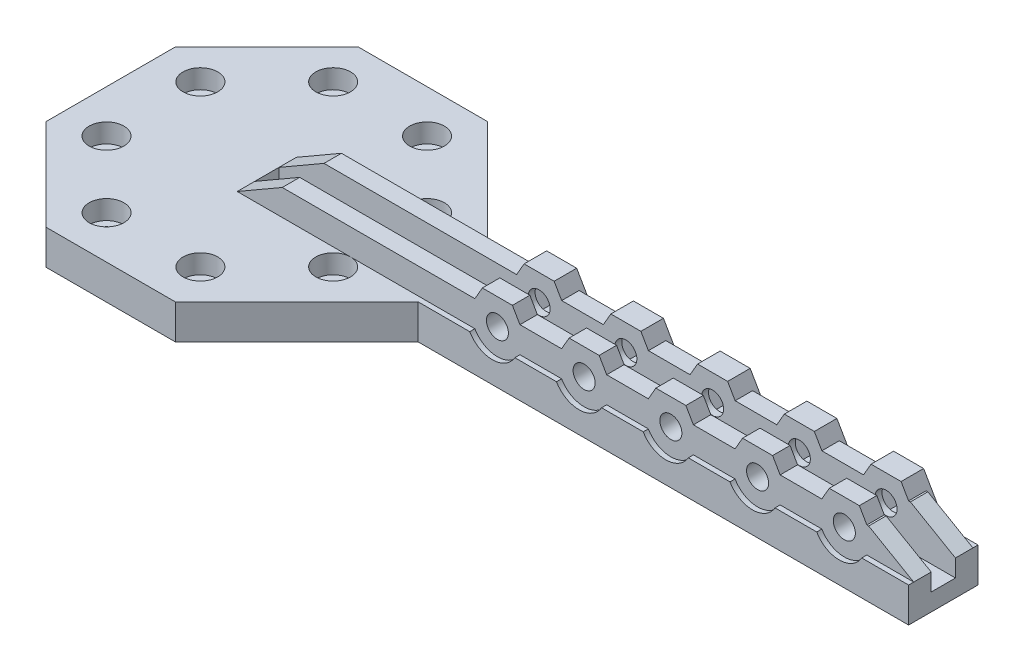
from build123d import *

# Parameters (mm, degrees)
BOSS_EXTRUDE1_DEPTH             = 10
SKETCH2_R                       = 2.85
CUT_EXTRUDE1_DEPTH              = 14
SKETCH5_R                       = 5
CUT_EXTRUDE2_DEPTH              = 5.5
SKETCH7_W                       = 150
SKETCH7_H                       = 20
BOSS_EXTRUDE3_DEPTH             = 10
SKETCH8_W                       = 195
SKETCH8_H                       = 5.029902504
BOSS_EXTRUDE4_DEPTH             = 7.5
BOSS_EXTRUDE5_REACH             = 204.461
BOSS_EXTRUDE5_DIRECTION_2_REACH = 204.461
CUT_EXTRUDE3_REACH              = 204.527
SKETCH10_W                      = 195
SKETCH10_H                      = 7
CUT_EXTRUDE4_DEPTH              = 5
SKETCH11_R                      = 3.175
CUT_EXTRUDE5_DEPTH              = 23
SKETCH12_R                      = 7.5
CUT_EXTRUDE6_DEPTH              = 1.470097496
SKETCH14_W                      = 7.794228634
SKETCH14_H                      = 5.029902504
BOSS_EXTRUDE6_DEPTH             = 1.5
CUT_EXTRUDE7_DEPTH              = 4.5
BOSS_EXTRUDE7_DEPTH             = 5.029902504
LPATTERN4_COUNT                 = 5
LPATTERN4_PITCH                 = 25


with BuildPart() as part:
    # Sketch1 → Boss-Extrude1 (new body)
    with BuildSketch(Plane(origin=(0, 0, 0), x_dir=(1, 0, 0), z_dir=(0, 1, 0))):
        Polygon((45, 18.639610307), (63.639610307, 0), (45, -18.639610307), (18.639610307, -45), (-18.639610307, -45), (-45, -18.639610307), (-45, 18.639610307), (-18.639610307, 45), (18.639610307, 45), align=None)
    extrude(amount=-BOSS_EXTRUDE1_DEPTH)

    # Sketch2 → Cut-Extrude1 (cut)
    with BuildSketch(Plane(origin=(0, 0, 0), x_dir=(1, 0, 0), z_dir=(0, 1, 0))):
        with Locations(Location((-32.664074122, -13.529902504, 0), (0, 0, 270))):
            Circle(SKETCH2_R)
        with Locations(Location((-32.664074122, 13.529902504, 0), (0, 0, 270))):
            Circle(SKETCH2_R)
        with Locations(Location((-13.529902504, 32.664074122, 0), (0, 0, 270))):
            Circle(SKETCH2_R)
        with Locations(Location((13.529902504, 32.664074122, 0), (0, 0, 270))):
            Circle(SKETCH2_R)
        with Locations(Location((32.664074122, 13.529902504, 0), (0, 0, 270))):
            Circle(SKETCH2_R)
        with Locations(Location((32.664074122, -13.529902504, 0), (0, 0, 270))):
            Circle(SKETCH2_R)
        with Locations(Location((13.529902504, -32.664074122, 0), (0, 0, 270))):
            Circle(SKETCH2_R)
        with Locations(Location((-13.529902504, -32.664074122, 0), (0, 0, 270))):
            Circle(SKETCH2_R)
    extrude(amount=-CUT_EXTRUDE1_DEPTH, mode=Mode.SUBTRACT)

    # Sketch5 → Cut-Extrude2 (cut)
    with BuildSketch(Plane(origin=(0, 0, 0), x_dir=(1, 0, 0), z_dir=(0, 1, 0))):
        with Locations(Location((-32.664074122, -13.529902504, 0), (0, 0, 270))):
            Circle(SKETCH5_R)
        with Locations(Location((-32.664074122, 13.529902504, 0), (0, 0, 270))):
            Circle(SKETCH5_R)
        with Locations(Location((-13.529902504, 32.664074122, 0), (0, 0, 270))):
            Circle(SKETCH5_R)
        with Locations(Location((13.529902504, 32.664074122, 0), (0, 0, 270))):
            Circle(SKETCH5_R)
        with Locations(Location((32.664074122, 13.529902504, 0), (0, 0, 270))):
            Circle(SKETCH5_R)
        with Locations(Location((32.664074122, -13.529902504, 0), (0, 0, 270))):
            Circle(SKETCH5_R)
        with Locations(Location((13.529902504, -32.664074122, 0), (0, 0, 270))):
            Circle(SKETCH5_R)
        with Locations(Location((-13.529902504, -32.664074122, 0), (0, 0, 270))):
            Circle(SKETCH5_R)
    extrude(amount=-CUT_EXTRUDE2_DEPTH, mode=Mode.SUBTRACT)

    # Sketch7 → Boss-Extrude3 (add)
    with BuildSketch(Plane(origin=(0, 0, 0), x_dir=(1, 0, 0), z_dir=(0, 1, 0))):
        with Locations((120, 0)):
            Rectangle(SKETCH7_W, SKETCH7_H)
    extrude(amount=-BOSS_EXTRUDE3_DEPTH)

    # Sketch8 → Boss-Extrude4 (add)
    with BuildSketch(Plane(origin=(0, 0, 0), x_dir=(1, 0, 0), z_dir=(0, 1, 0))):
        with Locations((97.5, -6.014951252)):
            Rectangle(SKETCH8_W, SKETCH8_H)
        with Locations((97.5, 6.014951252)):
            Rectangle(SKETCH8_W, SKETCH8_H)
    extrude(amount=BOSS_EXTRUDE4_DEPTH)

    # Boss-Extrude5: up to this face of the body (flat: up to its plane)
    boss_extrude5_end = Plane(part.part.faces().sort_by_distance((124.319805153, -5, -10))[0])
    # Sketch13 → Boss-Extrude5 (add, up to the picked face)
    with BuildSketch(Plane(origin=(0, 0, -8.529902504), x_dir=(-1, 0, 0), z_dir=(0, 0, -1)), mode=Mode.PRIVATE) as boss_extrude5_sk1:
        Polygon((-166.339745962, 3.75), (-170.669872981, 11.25), (-179.330127019, 11.25), (-183.660254038, 3.75), (-183.660254038, -3.75), (-166.339745962, -3.75), align=None)
        Polygon((-168.937822174, 3.75), (-171.968911087, 9), (-178.031088913, 9), (-181.062177826, 3.75), (-178.031088913, -1.5), (-171.968911087, -1.5), align=None, mode=Mode.SUBTRACT)
    boss_extrude5_tool1 = split(extrude(boss_extrude5_sk1.sketch, amount=BOSS_EXTRUDE5_REACH, mode=Mode.PRIVATE), bisect_by=boss_extrude5_end, keep=Keep.BOTH, mode=Mode.PRIVATE)
    boss_extrude5 = boss_extrude5_tool1.solids().sort_by(Axis((168.703241, 7.385436, -8.529903), (0, 0, -1)))[0]
    add(boss_extrude5)

    # Boss-Extrude5 direction 2: up to this face of the body (flat: up to its plane)
    boss_extrude5_direction_2_end = Plane(part.part.faces().sort_by_distance((97.5, 3.75, -3.5))[0])
    # Sketch13 → Boss-Extrude5 direction 2 (add, up to the picked face)
    with BuildSketch(Plane(origin=(0, 0, -8.529902504), x_dir=(-1, 0, 0), z_dir=(0, 0, -1)), mode=Mode.PRIVATE) as boss_extrude5_direction_2_sk1:
        Polygon((-166.339745962, 3.75), (-170.669872981, 11.25), (-179.330127019, 11.25), (-183.660254038, 3.75), (-183.660254038, -3.75), (-166.339745962, -3.75), align=None)
        Polygon((-168.937822174, 3.75), (-171.968911087, 9), (-178.031088913, 9), (-181.062177826, 3.75), (-178.031088913, -1.5), (-171.968911087, -1.5), align=None, mode=Mode.SUBTRACT)
    boss_extrude5_direction_2_tool1 = split(extrude(boss_extrude5_direction_2_sk1.sketch, amount=-BOSS_EXTRUDE5_DIRECTION_2_REACH, mode=Mode.PRIVATE), bisect_by=boss_extrude5_direction_2_end, keep=Keep.BOTH, mode=Mode.PRIVATE)
    boss_extrude5_direction_2 = boss_extrude5_direction_2_tool1.solids().sort_by(Axis((168.703241, 7.385436, -8.529903), (0, 0, 1)))[0]
    add(boss_extrude5_direction_2)

    # Cut-Extrude3: up to this face of the body (flat: up to its plane)
    cut_extrude3_end = Plane(part.part.faces().sort_by_distance((83.441968882, 3.75810856, -8.529902504))[0])
    # Sketch9 → Cut-Extrude3 (cut, up to the picked face)
    with BuildSketch(Plane.XY.offset(8.529902504), mode=Mode.PRIVATE) as cut_extrude3_sk1:
        Polygon((0, 0), (12.990381057, 7.5), (0, 7.5), align=None)
    cut_extrude3_tool1 = split(extrude(cut_extrude3_sk1.sketch, amount=-CUT_EXTRUDE3_REACH, mode=Mode.PRIVATE), bisect_by=cut_extrude3_end, keep=Keep.BOTH, mode=Mode.PRIVATE)
    # Sketch9 → Cut-Extrude3 (cut, up to the picked face)
    with BuildSketch(Plane.XY.offset(8.529902504), mode=Mode.PRIVATE) as cut_extrude3_sk2:
        Polygon((182.009618943, 7.5), (195, 0), (195, 7.5), align=None)
    cut_extrude3_tool2 = split(extrude(cut_extrude3_sk2.sketch, amount=-CUT_EXTRUDE3_REACH, mode=Mode.PRIVATE), bisect_by=cut_extrude3_end, keep=Keep.BOTH, mode=Mode.PRIVATE)
    add(cut_extrude3_tool1.solids().sort_by(Axis((4.330127, 5, 8.529903), (0, 0, -1)))[0], mode=Mode.SUBTRACT)
    add(cut_extrude3_tool2.solids().sort_by(Axis((190.669873, 5, 8.529903), (0, 0, -1)))[0], mode=Mode.SUBTRACT)

    # Sketch10 → Cut-Extrude4 (cut)
    with BuildSketch(Plane(origin=(0, 0, 0), x_dir=(1, 0, 0), z_dir=(0, 1, 0))):
        with Locations((97.5, 0)):
            Rectangle(SKETCH10_W, SKETCH10_H)
    extrude(amount=-CUT_EXTRUDE4_DEPTH, mode=Mode.SUBTRACT)

    # Sketch11 → Cut-Extrude5 (cut)
    with BuildSketch(Plane.XY.offset(8.529902504)):
        with Locations((175, 3.75)):
            Circle(SKETCH11_R)
    cut_extrude5 = extrude(amount=-CUT_EXTRUDE5_DEPTH, mode=Mode.SUBTRACT)

    # Sketch12 → Cut-Extrude6 (cut)
    with BuildSketch(Plane.XY.offset(10)):
        with Locations((175, 3.75)):
            Circle(SKETCH12_R)
    cut_extrude6 = extrude(amount=-CUT_EXTRUDE6_DEPTH, mode=Mode.SUBTRACT)

    # Sketch14 → Boss-Extrude6 (add)
    with BuildSketch(Plane(origin=(0, 7.5, 0), x_dir=(1, 0, 0), z_dir=(0, 1, 0))):
        with Locations((175, 6.014951252)):
            Rectangle(SKETCH14_W, SKETCH14_H)
    boss_extrude6 = extrude(amount=BOSS_EXTRUDE6_DEPTH)

    # Sketch15 → Cut-Extrude7 (cut)
    with BuildSketch(Plane(origin=(0, 0, -10), x_dir=(-1, 0, 0), z_dir=(0, 0, -1))):
        Polygon((-168.937822174, 3.75), (-171.968911087, 9), (-178.031088913, 9), (-181.062177826, 3.75), (-178.031088913, -1.5), (-171.968911087, -1.5), align=None)
    cut_extrude7 = extrude(amount=-CUT_EXTRUDE7_DEPTH, mode=Mode.SUBTRACT)

    # Sketch16 → Boss-Extrude7 (add)
    with BuildSketch(Plane.XY.offset(8.529902504)):
        Polygon((168.504809472, 7.5), (170.669872981, 11.25), (179.330127019, 11.25), (181.495190528, 7.5), align=None)
    boss_extrude7 = extrude(amount=-BOSS_EXTRUDE7_DEPTH)

    # LPattern4: Boss-Extrude5, Boss-Extrude5 direction 2, Cut-Extrude5, Cut-Extrude6, Boss-Extrude6, Cut-Extrude7, Boss-Extrude7 ×5
    with Locations(*[(-i * LPATTERN4_PITCH, 0, 0) for i in range(1, LPATTERN4_COUNT)]):
        add(boss_extrude5)
        add(boss_extrude5_direction_2)
        add(cut_extrude5, mode=Mode.SUBTRACT)
        add(cut_extrude6, mode=Mode.SUBTRACT)
        add(boss_extrude6)
        add(cut_extrude7, mode=Mode.SUBTRACT)
        add(boss_extrude7)


solid = part.part
